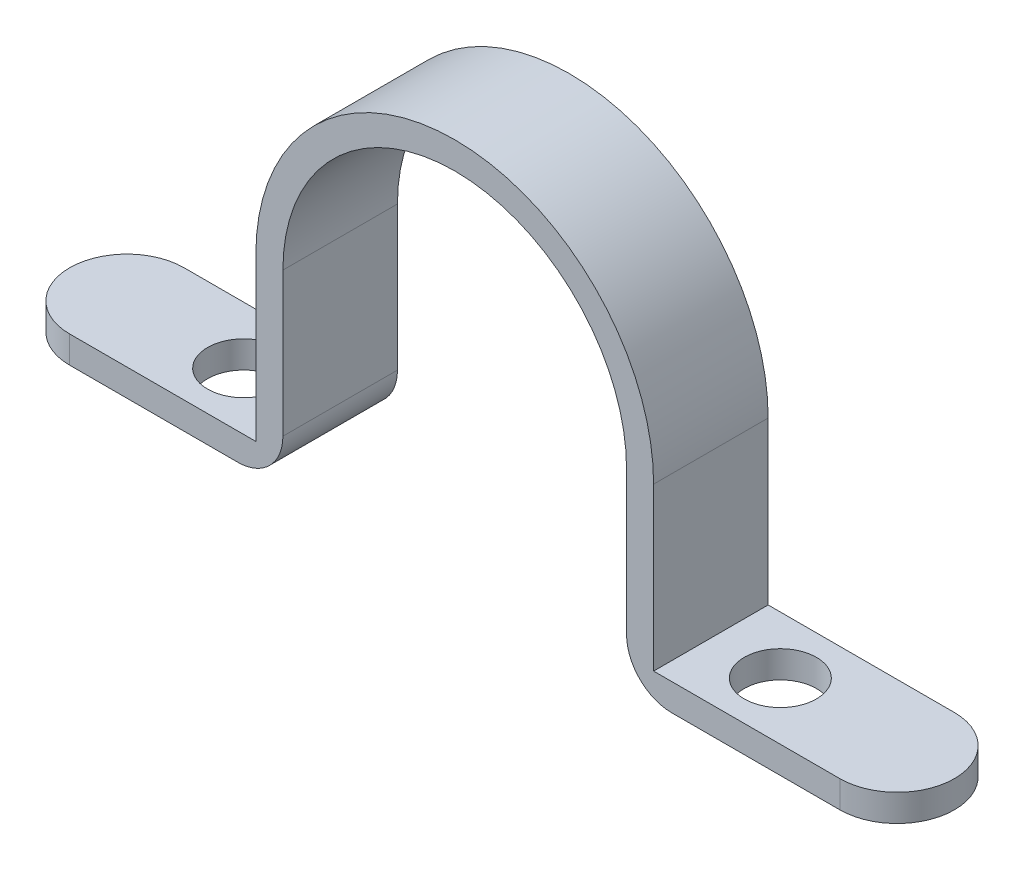
from build123d import *

# Parameters (mm, degrees)
BOSS_EXTRUDE1_DEPTH = 12.7
FILLET1_R           = 19.05
FILLET4_RADIUS      = 22.05
FILLET4_LENGTH      = 12.7
SKETCH2_R           = 4
CUT_EXTRUDE1_DEPTH  = 68.509113983
FILLET5_RADIUS      = 6.35
FILLET5_LENGTH      = 3
FILLET6_RADIUS      = 6.35
FILLET6_LENGTH      = 3
FILLET7_R           = 5


with BuildPart() as part:
    # Sketch1 → Boss-Extrude1 (new body)
    with BuildSketch(Plane.XY):
        Polygon((-45.220982698, 0), (-18.220982698, 0), (-18.220982698, 40), (25.879017302, 40), (25.879017302, 0), (52.879017302, 0), (52.879017302, -3), (22.879017302, -3), (22.879017302, 37), (-15.220982698, 37), (-15.220982698, -3), (-45.220982698, -3), align=None)
    extrude(amount=BOSS_EXTRUDE1_DEPTH)

    # Fillet1
    fillet1_edges = [part.edges().sort_by_distance(p)[0] for p in [
        (22.879017302, 37, 6.35),
        (-15.220982698, 37, 6.35),
    ]]
    fillet(fillet1_edges, radius=FILLET1_R - 0.0001)  # a hair under: the kernel refuses the full size

    # Fillet4: full round fillet: the end face becomes a half cylinder, R = half its width
    fillet4_face = Plane((3.829017302, 40, 6.35), x_dir=(0, 0, 1), z_dir=(0, 1, 0))  # on the end face: x along it, z out of the body
    fillet4_slab = fillet4_face.offset(-FILLET4_RADIUS / 2) * Box(FILLET4_LENGTH, 2 * FILLET4_RADIUS, FILLET4_RADIUS, mode=Mode.PRIVATE)  # the body's end, R deep
    fillet4_round = Plane((3.829017302, 17.95, 6.35), x_dir=(0, 1, 0), z_dir=(0, 0, 1)) * Cylinder(FILLET4_RADIUS, FILLET4_LENGTH, mode=Mode.PRIVATE)  # its axis R under the face
    add(fillet4_slab - fillet4_round, mode=Mode.SUBTRACT)

    # Sketch2 → Cut-Extrude1 (cut, through all)
    with BuildSketch(Plane(origin=(0, 0, 0), x_dir=(1, 0, 0), z_dir=(0, 1, 0))):
        with Locations(Location((-25.920982698, -6.35, 0), (0, 0, 270))):
            Circle(SKETCH2_R)
        with Locations(Location((33.579017302, -6.35, 0), (0, 0, 270))):
            Circle(SKETCH2_R)
    extrude(amount=-CUT_EXTRUDE1_DEPTH, mode=Mode.SUBTRACT)

    # Fillet5: full round fillet: the end face becomes a half cylinder, R = half its width
    fillet5_face = Plane((-45.220982698, -1.5, 6.35), x_dir=(0, -1, 0), z_dir=(-1, 0, 0))  # on the end face: x along it, z out of the body
    fillet5_slab = fillet5_face.offset(-FILLET5_RADIUS / 2) * Box(FILLET5_LENGTH, 2 * FILLET5_RADIUS, FILLET5_RADIUS, mode=Mode.PRIVATE)  # the body's end, R deep
    fillet5_round = Plane((-38.870982698, -1.5, 6.35), x_dir=(-1, 0, 0), z_dir=(0, -1, 0)) * Cylinder(FILLET5_RADIUS, FILLET5_LENGTH, mode=Mode.PRIVATE)  # its axis R under the face
    add(fillet5_slab - fillet5_round, mode=Mode.SUBTRACT)

    # Fillet6: full round fillet: the end face becomes a half cylinder, R = half its width
    fillet6_face = Plane((52.879017302, -1.5, 6.35), x_dir=(0, 1, 0), z_dir=(1, 0, 0))  # on the end face: x along it, z out of the body
    fillet6_slab = fillet6_face.offset(-FILLET6_RADIUS / 2) * Box(FILLET6_LENGTH, 2 * FILLET6_RADIUS, FILLET6_RADIUS, mode=Mode.PRIVATE)  # the body's end, R deep
    fillet6_round = Plane((46.529017302, -1.5, 6.35), x_dir=(1, 0, 0), z_dir=(0, 1, 0)) * Cylinder(FILLET6_RADIUS, FILLET6_LENGTH, mode=Mode.PRIVATE)  # its axis R under the face
    add(fillet6_slab - fillet6_round, mode=Mode.SUBTRACT)

    # Fillet7
    fillet7_edges = [part.edges().sort_by_distance(p)[0] for p in [
        (22.879017302, -3, 6.35),
        (-15.220982698, -3, 6.35),
    ]]
    fillet(fillet7_edges, radius=FILLET7_R)


solid = part.part
